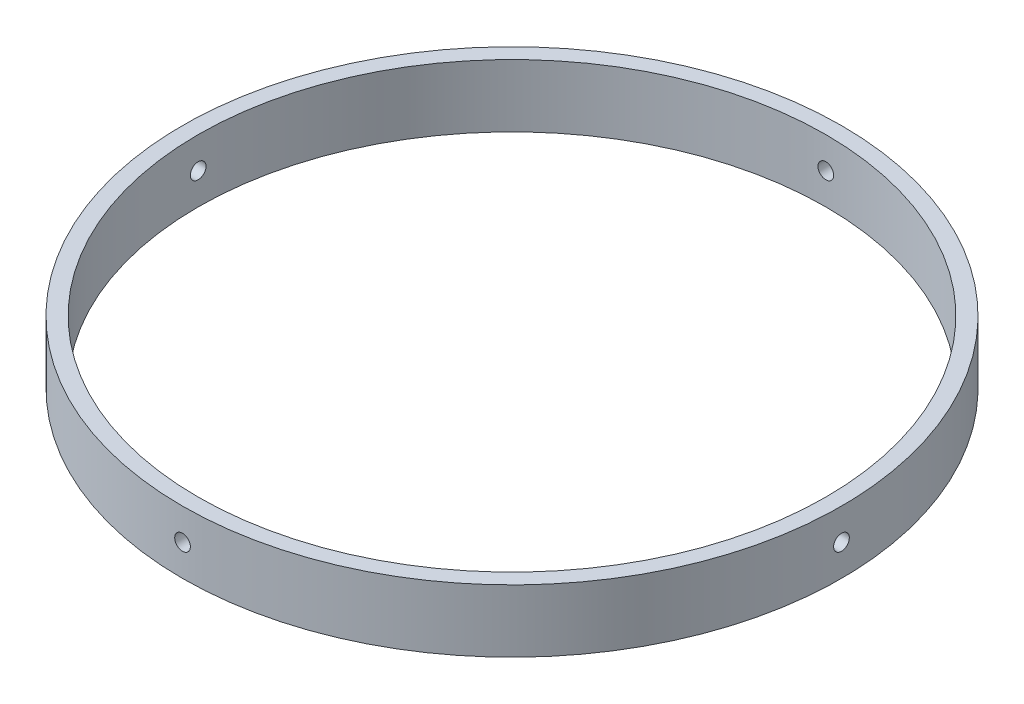
from build123d import *

# Parameters (mm, degrees)
SKETCH1_R               = 66.802
SKETCH1_R_2             = 63.627
BOSS_EXTRUDE1_DEPTH     = 12.7
CUT_EXTRUDE1_REACH      = 97.322
CUT_EXTRUDE1_END_RADIUS = 66.802
SKETCH2_R               = 1.5875
CIRPATTERN1_COUNT       = 4


with BuildPart() as part:
    # Sketch1 → Boss-Extrude1 (new body)
    with BuildSketch(Plane(origin=(0, 0, 0), x_dir=(1, 0, 0), z_dir=(0, 1, 0))):
        Circle(SKETCH1_R)
        Circle(SKETCH1_R_2, mode=Mode.SUBTRACT)
    extrude(amount=BOSS_EXTRUDE1_DEPTH)

    # Cut-Extrude1: up to this cylinder (the profile starts inside it)
    cut_extrude1_end = Plane(origin=(0, 6.35, 0), z_dir=(0, -1, 0)) * Cylinder(CUT_EXTRUDE1_END_RADIUS, 329.248, mode=Mode.PRIVATE)
    # Sketch2 → Cut-Extrude1 (cut, up to the surface)
    with BuildSketch(Plane.XY, mode=Mode.PRIVATE) as cut_extrude1_sk1:
        with Locations((0, 6.35)):
            Circle(SKETCH2_R)
    cut_extrude1_tool1 = extrude(cut_extrude1_sk1.sketch, amount=-CUT_EXTRUDE1_REACH, mode=Mode.PRIVATE) & cut_extrude1_end
    cut_extrude1 = cut_extrude1_tool1.solids().sort_by_distance((0, 6.35, 0))[0]
    add(cut_extrude1, mode=Mode.SUBTRACT)

    # CirPattern1: Cut-Extrude1 ×4 about axis
    cirpattern1_axis = Axis((0, 12.7, 0), (0, -1, 0))
    for i in range(1, CIRPATTERN1_COUNT):
        add(cut_extrude1.rotate(cirpattern1_axis, i * 360 / CIRPATTERN1_COUNT), mode=Mode.SUBTRACT)


solid = part.part
